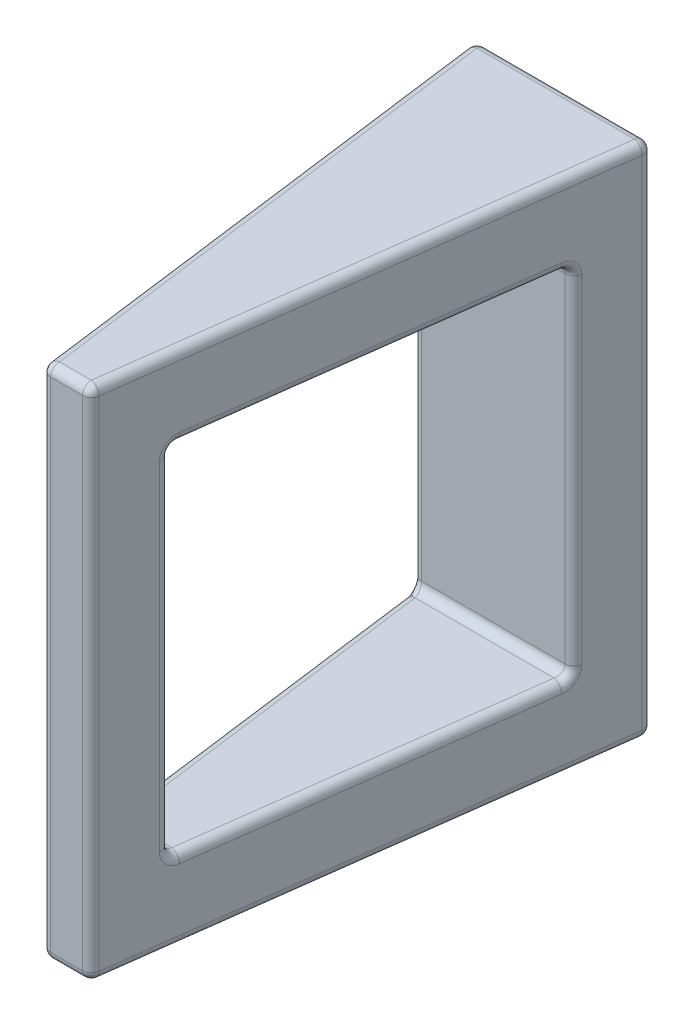
from build123d import *

# Parameters (mm, degrees)
A_FRAME_BODY_DEPTH       = 92.075
A_FRAME_BODY_DEPTH_BACK  = 92.075
WINDOW_CUTOUT_DEPTH      = 203.728163127
WINDOW_CUTOUT_DEPTH_BACK = 203.728163127
WINDOW_SKETCH_W          = 127
WINDOW_SKETCH_H          = 127
MOUNTING_HOLES_SKETCH_R  = 3.96875
MOUNTING_HOLES_DEPTH     = 12.7
EXTERNAL_FILLETS_R       = 3.175


with BuildPart() as part:
    # A-Frame Profile → A-Frame Body (new, two sides: drawn at the far end of the back side and taken through both)
    with BuildSketch(Plane(origin=(0, 0, 0), x_dir=(-1, 0, 0), z_dir=(0, 1, 0)).offset(-A_FRAME_BODY_DEPTH_BACK)):
        Polygon((-31.75, 0), (31.75, 0), (8.466666667, 177.8), (-8.466666667, 177.8), align=None)
    extrude(amount=A_FRAME_BODY_DEPTH + A_FRAME_BODY_DEPTH_BACK)

    # Window Sketch → Window Cutout (cut, two sides: drawn at the far end of the back side and taken through both)
    with BuildSketch(Plane.YZ.offset(-WINDOW_CUTOUT_DEPTH_BACK)):
        with Locations((0, 88.9)):
            Rectangle(WINDOW_SKETCH_W, WINDOW_SKETCH_H)
    extrude(amount=WINDOW_CUTOUT_DEPTH + WINDOW_CUTOUT_DEPTH_BACK, mode=Mode.SUBTRACT)

    # Mounting Holes Sketch → Mounting Holes (cut)
    with BuildSketch(Plane(origin=(0, 0, 0), x_dir=(0, 1, 0), z_dir=(0, 0, 1))):
        with Locations((-31.75, 0)):
            Circle(MOUNTING_HOLES_SKETCH_R)
        with Locations((31.75, 0)):
            Circle(MOUNTING_HOLES_SKETCH_R)
    extrude(amount=MOUNTING_HOLES_DEPTH, mode=Mode.SUBTRACT)

    # External Fillets
    external_fillets_edges = [part.edges().sort_by_distance(p)[0] for p in [
        (0, 27.78125, 12.7),
        (0, 27.78125, 0),
        (0, -35.71875, 0),
        (0, -35.71875, 12.7),
        (0, -63.5, 25.4),
        (0, 63.5, 25.4),
        (0, 63.5, 152.4),
        (0, -63.5, 152.4),
        (28.423809524, 0, 25.4),
        (20.108333333, 63.5, 88.9),
        (11.792857143, 0, 152.4),
        (20.108333333, -63.5, 88.9),
        (20.108333333, 92.075, 88.9),
        (0, 92.075, 0),
        (-20.108333333, 92.075, 88.9),
        (0, 92.075, 177.8),
        (20.108333333, -92.075, 88.9),
        (0, -92.075, 0),
        (-20.108333333, -92.075, 88.9),
        (0, -92.075, 177.8),
        (31.75, 0, 0),
        (-31.75, 0, 0),
        (-8.466666667, 0, 177.8),
        (8.466666667, 0, 177.8),
        (-28.423809524, 0, 25.4),
        (-20.108333333, 63.5, 88.9),
        (-11.792857143, 0, 152.4),
        (-20.108333333, -63.5, 88.9),
    ]]
    fillet(external_fillets_edges, radius=EXTERNAL_FILLETS_R)


solid = part.part
